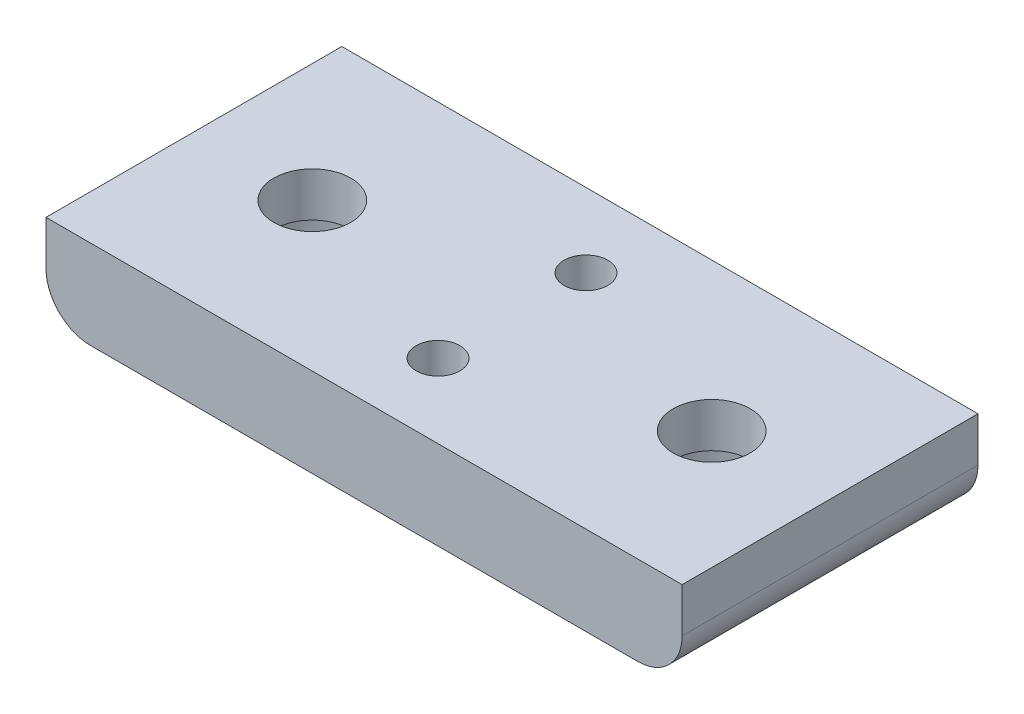
from build123d import *

# Parameters (mm, degrees)
SKETCH_1_W      = 43
SKETCH_1_H      = 20
SKETCH_1_R      = 5
SKETCH_1_R_2    = 1.48
EXTRUDE_1_DEPTH = 6
EXTRUDE_START   = -3
SKETCH_2_R      = 5
SKETCH_2_R_2    = 2.6
EXTRUDE_2_DEPTH = 3
FILLET_1_R      = 3


with BuildPart() as part:
    # 草图1 → 凸台-拉伸1 (new body)
    with BuildSketch(Plane(origin=(0, 0, 0), x_dir=(1, 0, 0), z_dir=(0, 1, 0))):
        with Locations((21.5, 10)):
            Rectangle(SKETCH_1_W, SKETCH_1_H)
        with Locations(Location((8, 10, 0), (0, 0, 270))):
            Circle(SKETCH_1_R, mode=Mode.SUBTRACT)
        with Locations(Location((35, 10, 0), (0, 0, 270))):
            Circle(SKETCH_1_R, mode=Mode.SUBTRACT)
        with Locations(Location((21.5, 15, 0), (0, 0, 270))):
            Circle(SKETCH_1_R_2, mode=Mode.SUBTRACT)
        with Locations(Location((21.5, 5, 0), (0, 0, 270))):
            Circle(SKETCH_1_R_2, mode=Mode.SUBTRACT)
    extrude(amount=EXTRUDE_1_DEPTH)

    # 草图2 → 凸台-拉伸2 (add)
    # profile 1 of 2: a face of its own
    with BuildSketch(Plane(origin=(0, 6, 0), x_dir=(1, 0, 0), z_dir=(0, 1, 0)).offset(EXTRUDE_START)):
        with Locations(Location((8, 10, 0), (0, 0, 270))):
            Circle(SKETCH_2_R)
        with Locations(Location((8, 10, 0), (0, 0, 270))):
            Circle(SKETCH_2_R_2, mode=Mode.SUBTRACT)
    # profile 2 of 2: a face of its own
    with BuildSketch(Plane(origin=(0, 6, 0), x_dir=(1, 0, 0), z_dir=(0, 1, 0)).offset(EXTRUDE_START)):
        with Locations(Location((35, 10, 0), (0, 0, 270))):
            Circle(SKETCH_2_R)
        with Locations(Location((35, 10, 0), (0, 0, 270))):
            Circle(SKETCH_2_R_2, mode=Mode.SUBTRACT)
    extrude(amount=EXTRUDE_2_DEPTH)

    # 圆角1
    fillet_1_edges = [part.edges().sort_by_distance(p)[0] for p in [
        (43, 0, -10),
        (0, 0, -10),
    ]]
    fillet(fillet_1_edges, radius=FILLET_1_R - 0.0001)  # a hair under: the kernel refuses the full size


solid = part.part
